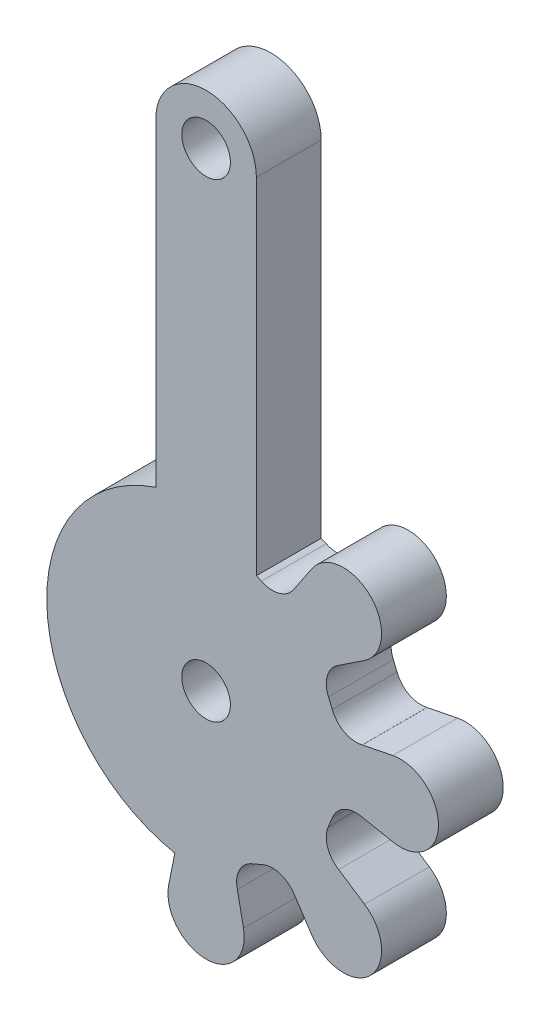
from build123d import *

# Parameters (mm, degrees)
SKETCH1_R           = 1.49999983
SKETCH1_R_2         = 1.50000021
BOSS_EXTRUDE5_DEPTH = 4


# Read off the part's stored shape, not the designer's step: Imported1
with BuildPart() as part:
    # Sketch1 → Boss-Extrude5 (new body)
    with BuildSketch(Plane.XY.offset(4.00000019)):
        with BuildLine():
            ThreePointArc((12.937500142, 43.342541903), (9.832499729, 46.447540761), (6.727500353, 43.342540866))
            Line((6.727500353, 43.342540866), (6.727500353, 23.671906441))
            ThreePointArc((6.727500353, 23.671906441), (0.018793936, 13.734902419), (7.902105327, 4.701398545))
            Line((7.902105327, 4.701398545), (7.524421789, 2.816406275))
            ThreePointArc((7.524421789, 2.816406275), (9.832500014, -5.9e-08), (12.14057824, 2.816406275))
            Line((12.14057824, 2.816406275), (11.762894778, 4.701398162))
            ThreePointArc((11.762894778, 4.701398162), (11.855672679, 5.730610746), (12.571502338, 6.475912151))
            ThreePointArc((12.571502338, 6.475912151), (12.653825046, 6.514541951), (12.738259166, 6.548308343))
            Line((12.738259166, 6.548308343), (13.279813023, 6.783419776))
            ThreePointArc((13.279813023, 6.783419776), (14.401344572, 6.854545961), (15.285156295, 6.160450299))
            Line((15.285156295, 6.160450299), (16.318864329, 4.609298912))
            ThreePointArc((16.318864329, 4.609298912), (19.954946163, 4.181790528), (19.61122341, 7.826747207))
            Line((19.61122341, 7.826747207), (18.012888788, 8.887330785))
            ThreePointArc((18.012888788, 8.887330785), (17.330815892, 9.745478763), (17.369938897, 10.840974441))
            Line((17.369938897, 10.840974441), (17.631297478, 11.478005982))
            ThreePointArc((17.631297478, 11.478005982), (18.378744789, 12.287790328), (19.473690584, 12.412377153))
            Line((19.473690584, 12.412377153), (21.358352668, 12.034519282))
            ThreePointArc((21.358352668, 12.034519282), (24.175042258, 14.342908104), (21.357632561, 16.650417974))
            Line((21.357632561, 16.650417974), (19.473808661, 16.272116711))
            ThreePointArc((19.473808661, 16.272116711), (19.473514795, 16.273584463), (19.473220705, 16.27505217))
            ThreePointArc((19.473220705, 16.27505217), (18.361090509, 16.40624384), (17.619571753, 17.245406971))
            Line((17.619571753, 17.245406971), (17.390357149, 17.796567545))
            ThreePointArc((17.390357149, 17.796567545), (17.322929979, 18.914964617), (18.012888788, 19.79775297))
            Line((18.012888788, 19.79775297), (19.611220282, 20.858331838))
            ThreePointArc((19.611220282, 20.858331838), (19.975539072, 24.482917782), (16.35037502, 24.124397156))
            Line((16.35037502, 24.124397156), (15.285156295, 22.524633456))
            ThreePointArc((15.285156295, 22.524633456), (15.284091495, 22.525342953), (15.283026603, 22.526052311))
            ThreePointArc((15.283026603, 22.526052311), (14.383790145, 21.826291172), (13.248170262, 21.919346761))
            Line((13.248170262, 21.919346761), (12.937500142, 22.051239386))
            Line((12.937500142, 22.051239386), (12.937500142, 23.67190695))
            Line((12.937500142, 23.67190695), (12.937500142, 43.342541903))
        make_face()
        with Locations((9.832499965, 14.342541504)):
            Circle(SKETCH1_R, mode=Mode.SUBTRACT)
        with Locations((9.832500097, 43.342539793)):
            Circle(SKETCH1_R_2, mode=Mode.SUBTRACT)
    extrude(amount=BOSS_EXTRUDE5_DEPTH)


solid = part.part
